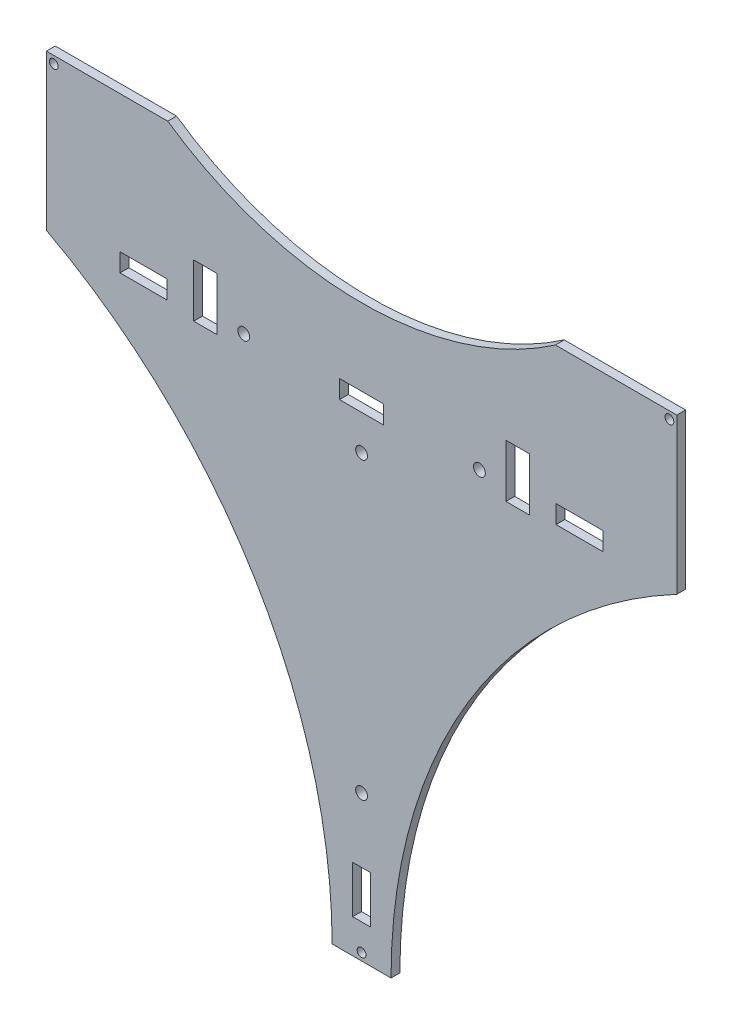
from build123d import *

# Parameters (mm, degrees)
SKETCH1_R           = 1.5
SKETCH1_R_2         = 2
SKETCH1_W           = 8
SKETCH1_H           = 18
SKETCH1_W_2         = 16
SKETCH1_H_2         = 6.2
SKETCH1_W_3         = 6.1
SKETCH1_H_3         = 16
SKETCH1_W_4         = 15
BOSS_EXTRUDE1_DEPTH = 3


with BuildPart() as part:
    # Sketch1 → Boss-Extrude1 (new body)
    with BuildSketch(Plane.XY):
        with BuildLine():
            Line((86.201143473, 107), (107, 107))
            Line((107, 107), (107, 54.3))
            ThreePointArc((107, 54.3), (36.117719554, -12.890104134), (10, -107))
            Line((10, -107), (-10, -107))
            ThreePointArc((-10, -107), (-36.117719554, -12.890104134), (-107, 54.3))
            Line((-107, 54.3), (-107, 107))
            Line((-107, 107), (-91.798856527, 107))
            Line((-91.798856527, 107), (-65.806668714, 107))
            ThreePointArc((-65.806668714, 107), (0, 86.5), (65.806668714, 107))
            Line((65.806668714, 107), (86.201143473, 107))
        make_face()
        with Locations((-104.5, 104.5)):
            Circle(SKETCH1_R, mode=Mode.SUBTRACT)
        with Locations((104.5, 104.5)):
            Circle(SKETCH1_R, mode=Mode.SUBTRACT)
        with Locations((-40, 57.4)):
            Circle(SKETCH1_R_2, mode=Mode.SUBTRACT)
        with Locations((0, 42.4)):
            Circle(SKETCH1_R_2, mode=Mode.SUBTRACT)
        with Locations((0, -104.5)):
            Circle(SKETCH1_R, mode=Mode.SUBTRACT)
        with Locations((0, -57.6)):
            Circle(SKETCH1_R_2, mode=Mode.SUBTRACT)
        with Locations((40, 57.4)):
            Circle(SKETCH1_R_2, mode=Mode.SUBTRACT)
        with Locations((53, 61.6)):
            Rectangle(SKETCH1_W, SKETCH1_H, mode=Mode.SUBTRACT)
        with Locations((-74, 57.4)):
            Rectangle(SKETCH1_W_2, SKETCH1_H_2, mode=Mode.SUBTRACT)
        with Locations((74, 57.4)):
            Rectangle(SKETCH1_W_2, SKETCH1_H_2, mode=Mode.SUBTRACT)
        with Locations((0, -87.5)):
            Rectangle(SKETCH1_W_3, SKETCH1_H_3, mode=Mode.SUBTRACT)
        with Locations((-53, 61.6)):
            Rectangle(SKETCH1_W, SKETCH1_H, mode=Mode.SUBTRACT)
        with Locations((0, 57.4)):
            Rectangle(SKETCH1_W_4, SKETCH1_H_2, mode=Mode.SUBTRACT)
    extrude(amount=BOSS_EXTRUDE1_DEPTH)


solid = part.part
